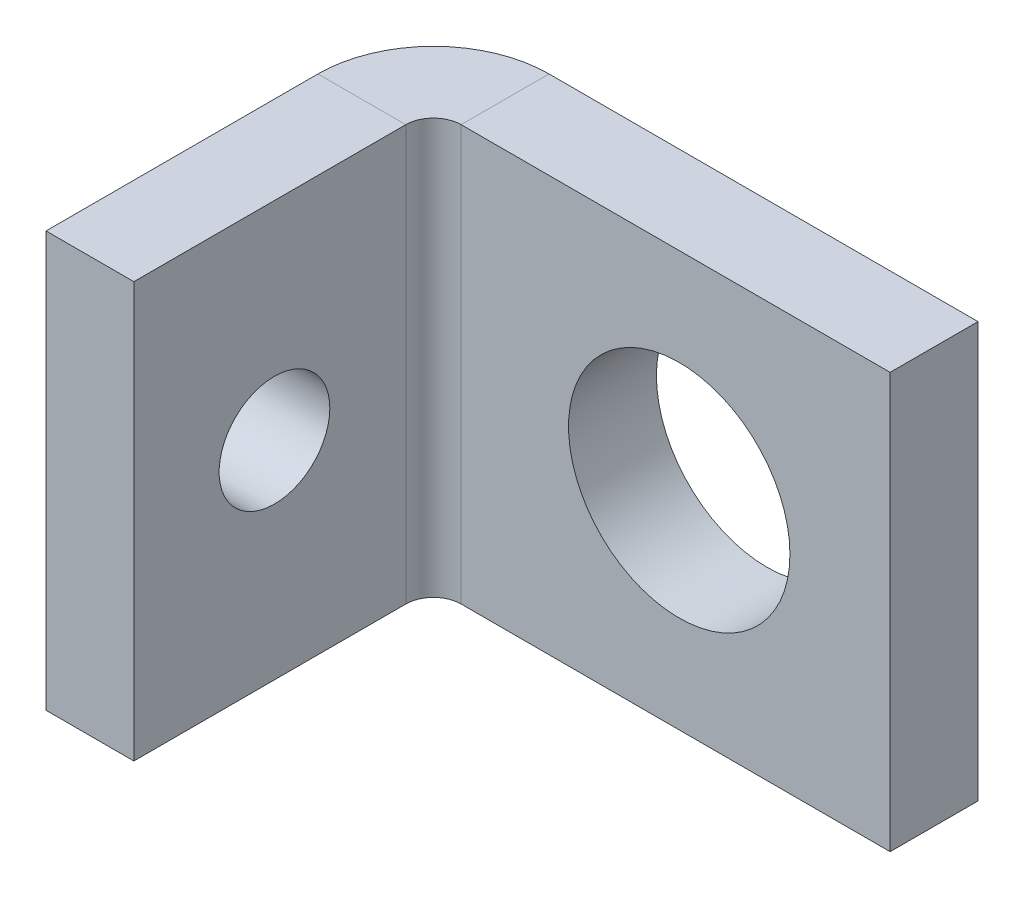
from build123d import *

# Parameters (mm, degrees)
SKETCH1_W                    = 16.5
SKETCH1_H                    = 15
BASE_FLANGE1_DEPTH           = 3.175
EDGE_FLANGE1_STRIP_W         = 14.7
EDGE_FLANGE1_STRIP_H         = 3.175
EDGE_FLANGE1_STRIP_CUT_DEPTH = 15
EDGE_FLANGE1_DEPTH           = 15
SKETCH9_R                    = 4
CUT_EXTRUDE1_DEPTH           = 10
SKETCH10_R                   = 2
CUT_EXTRUDE2_DEPTH           = 10


# Sheet-metal steps are written as plain solids
with BuildPart() as part:
    # Sketch1 → Base-Flange1 (new body)
    with BuildSketch(Plane.XY):
        Rectangle(SKETCH1_W, SKETCH1_H)
    extrude(amount=BASE_FLANGE1_DEPTH)

    # Edge-Flange1 strip (across the edge) → Edge-Flange1 strip cut (cut)
    with BuildSketch(Plane(origin=(-8.25, 7.5, 3.175), x_dir=(1, 0, 0), z_dir=(0, -1, 0))):
        with Locations((-6.35, -1.5875)):
            Rectangle(EDGE_FLANGE1_STRIP_W, EDGE_FLANGE1_STRIP_H)
    extrude(amount=EDGE_FLANGE1_STRIP_CUT_DEPTH, mode=Mode.SUBTRACT)

    # Edge-Flange1 section (across the edge) → Edge-Flange1 (add)
    with BuildSketch(Plane(origin=(-8.25, 7.5, 3.175), x_dir=(1, 0, 0), z_dir=(0, -1, 0))):
        with BuildLine():
            Line((-3.175, 1), (-3.175, 10.825))
            Line((-3.175, 10.825), (0, 10.825))
            Line((0, 10.825), (0, 1))
            ThreePointArc((0, 1), (0.292893219, 0.292893219), (1, 0))
            Line((1, 0), (1, -3.175))
            ThreePointArc((1, -3.175), (-1.952170811, -1.952170811), (-3.175, 1))
        make_face()
    extrude(amount=EDGE_FLANGE1_DEPTH)

    # Sketch9 → Cut-Extrude1 (cut)
    with BuildSketch(Plane.XY.offset(3.175)):
        with Locations((0.63, 0)):
            Circle(SKETCH9_R)
    extrude(amount=-CUT_EXTRUDE1_DEPTH, mode=Mode.SUBTRACT)

    # Sketch10 → Cut-Extrude2 (cut)
    with BuildSketch(Plane(origin=(-8.25, 0, 0), x_dir=(0, 0, -1), z_dir=(1, 0, 0))):
        with Locations((-8.92, 0)):
            Circle(SKETCH10_R)
    extrude(amount=-CUT_EXTRUDE2_DEPTH, mode=Mode.SUBTRACT)


solid = part.part
